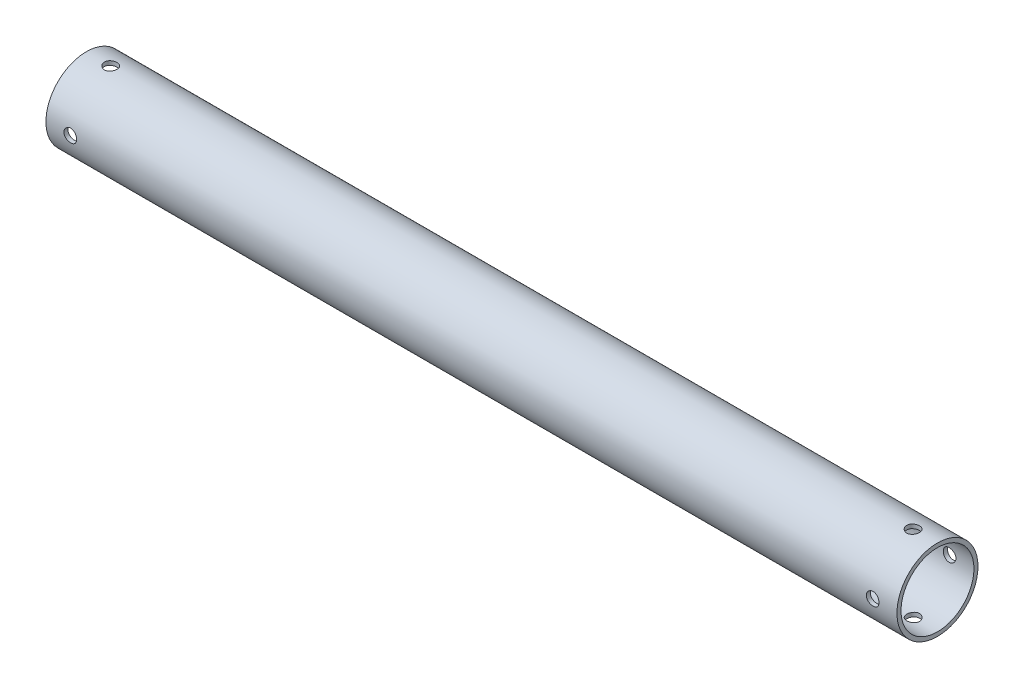
from build123d import *

# Parameters (mm, degrees)
SKETCH1_R               = 15.875
SKETCH1_R_2             = 14.2875
EXTRUDE_THIN1_DEPTH     = 166.6875
CUT_EXTRUDE1_DEPTH      = 169.192609547
CUT_EXTRUDE1_DEPTH_BACK = 169.192609547
SKETCH3_R               = 2.4892
CUT_EXTRUDE2_DEPTH      = 169.192609665
CUT_EXTRUDE2_DEPTH_BACK = 169.192609665
SKETCH4_R               = 2.4892


with BuildPart() as part:
    # Sketch1 → Extrude-Thin1 (new, symmetric)
    with BuildSketch(Plane(origin=(0, 0, 0), x_dir=(0, 0, -1), z_dir=(1, 0, 0))):
        Circle(SKETCH1_R)
        Circle(SKETCH1_R_2, mode=Mode.SUBTRACT)
    extrude(amount=EXTRUDE_THIN1_DEPTH, both=True)

    # Sketch3 → Cut-Extrude1 (cut, two sides: drawn at the far end of the back side and taken through both)
    with BuildSketch(Plane.XY.offset(-CUT_EXTRUDE1_DEPTH_BACK)):
        with Locations((157.1625, 0)):
            Circle(SKETCH3_R)
        with Locations((-157.1625, 0)):
            Circle(SKETCH3_R)
    extrude(amount=CUT_EXTRUDE1_DEPTH + CUT_EXTRUDE1_DEPTH_BACK, mode=Mode.SUBTRACT)

    # Sketch4 → Cut-Extrude2 (cut, two sides: drawn at the far end of the back side and taken through both)
    with BuildSketch(Plane(origin=(0, 0, 0), x_dir=(1, 0, 0), z_dir=(0, 1, 0)).offset(-CUT_EXTRUDE2_DEPTH_BACK)):
        with Locations((157.1625, 0)):
            Circle(SKETCH4_R)
        with Locations((-157.162462945, 0)):
            Circle(SKETCH4_R)
    extrude(amount=CUT_EXTRUDE2_DEPTH + CUT_EXTRUDE2_DEPTH_BACK, mode=Mode.SUBTRACT)


solid = part.part
